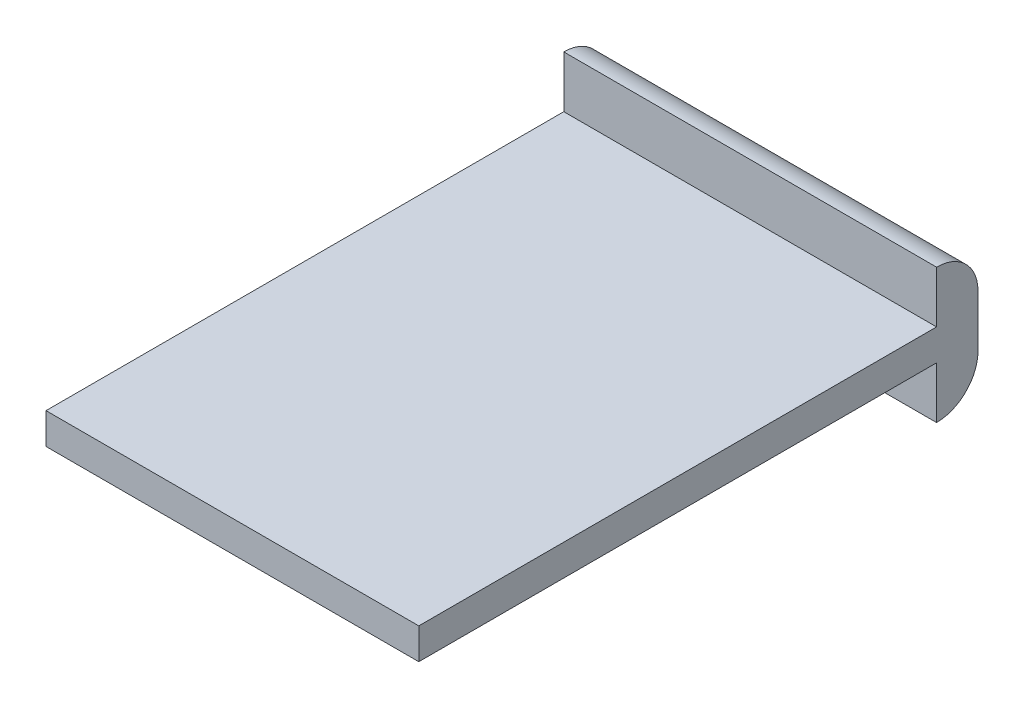
from build123d import *

# Parameters (mm, degrees)
SKETCH1_W           = 18
SKETCH1_H           = 25
BOSS_EXTRUDE1_DEPTH = 1.5
BOSS_EXTRUDE2_DEPTH = 2
FILLET1_R           = 2


with BuildPart() as part:
    # Sketch1 → Boss-Extrude1 (new body)
    with BuildSketch(Plane(origin=(0, 0, 0), x_dir=(1, 0, 0), z_dir=(0, 1, 0))):
        with Locations((9, 12.5)):
            Rectangle(SKETCH1_W, SKETCH1_H)
    extrude(amount=BOSS_EXTRUDE1_DEPTH)

    # Sketch2 → Boss-Extrude2 (add)
    with BuildSketch(Plane(origin=(0, 0, -25), x_dir=(-1, 0, 0), z_dir=(0, 0, -1))):
        Polygon((-18, 0), (-18, -2.5), (0, -2.5), (0, 4), (-18, 4), align=None)
    extrude(amount=BOSS_EXTRUDE2_DEPTH)

    # Fillet1
    fillet1_edges = [part.edges().sort_by_distance(p)[0] for p in [
        (9, 4, -27),
        (9, -2.5, -27),
    ]]
    fillet(fillet1_edges, radius=FILLET1_R - 0.0001)  # a hair under: the kernel refuses the full size


solid = part.part
